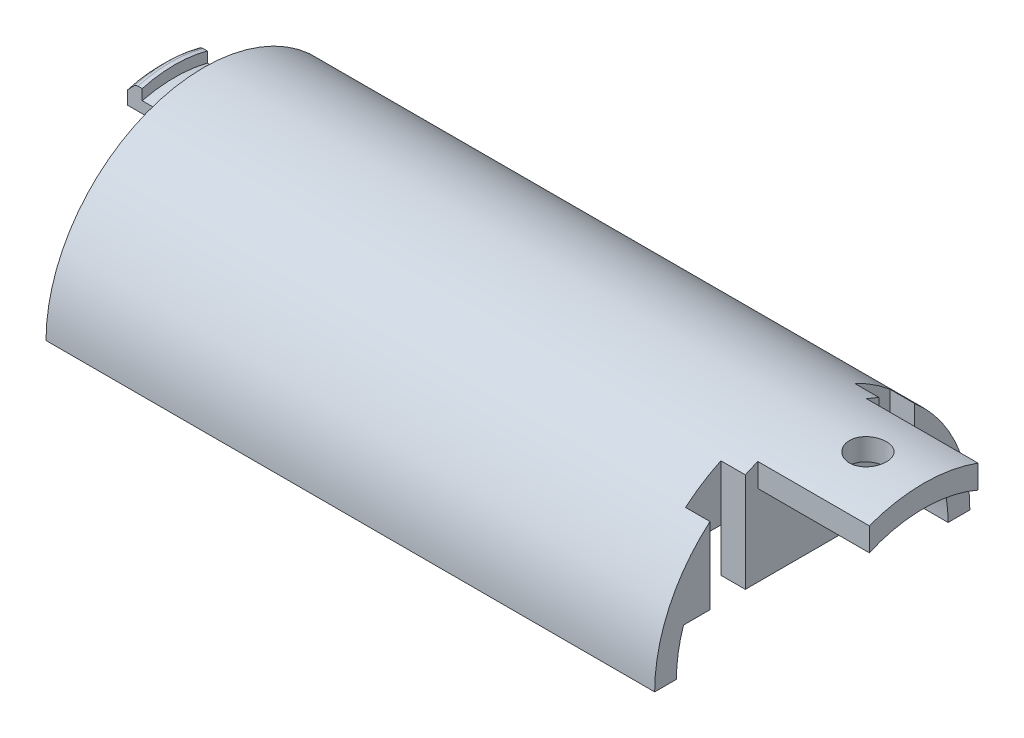
from build123d import *

# Parameters (mm, degrees)
SALIENTE_EXTRUIR1_DEPTH  = 30.75
SALIENTE_EXTRUIR2_DEPTH  = 2
SALIENTE_EXTRUIR3_DEPTH  = 20
SALIENTE_EXTRUIR4_START  = 3
SALIENTE_EXTRUIR4_DEPTH  = 3
CROQUIS6_W               = 2
CROQUIS6_H               = 6
SALIENTE_EXTRUIR6_DEPTH  = 2.5
CORTAR_EXTRUIR1_REACH    = 66.829
SALIENTE_EXTRUIR7_START  = 4
SALIENTE_EXTRUIR7_DEPTH  = 4
SALIENTE_EXTRUIR9_DEPTH  = 1.35
CHAFL_N3_SIZE            = 0.75
REDONDEO1_R              = 0.5
CHAFL_N4_SIZE            = 1
CORTAR_EXTRUIR2_DEPTH    = 5.5
SALIENTE_EXTRUIR10_START = 10.25
SALIENTE_EXTRUIR10_DEPTH = 10.25
CORTAR_EXTRUIR3_REACH    = 42.997
CROQUIS11_R              = 1.7
CROQUIS14_W              = 2.25
CROQUIS14_H              = 3.25
CORTAR_EXTRUIR6_DEPTH    = 40.758647011


with BuildPart() as part:
    # Croquis2 → Saliente-Extruir1 (new, symmetric)
    with BuildSketch(Plane.YZ):
        with BuildLine():
            Line((0, -12.5), (0, -14.5))
            ThreePointArc((0, -14.5), (14.5, 0), (0, 14.5))
            Line((0, 14.5), (0, 12.5))
            ThreePointArc((0, 12.5), (12.5, 0), (0, -12.5))
        make_face()
    extrude(amount=SALIENTE_EXTRUIR1_DEPTH, both=True)

    # Croquis3 → Saliente-Extruir2 (add)
    with BuildSketch(Plane(origin=(-21.75, 0, 0), x_dir=(0, 0, -1), z_dir=(1, 0, 0))):
        with BuildLine():
            Line((-12.5, 0), (-3.75, 0))
            ThreePointArc((-3.75, 0), (0, 3.75), (3.75, 0))
            Line((3.75, 0), (12.5, 0))
            ThreePointArc((12.5, 0), (0, 12.5), (-12.5, 0))
        make_face()
    extrude(amount=-SALIENTE_EXTRUIR2_DEPTH)

    # Croquis4 → Saliente-Extruir3 (add)
    with BuildSketch(Plane(origin=(23, 0, 0), x_dir=(0, 0, -1), z_dir=(1, 0, 0))):
        with BuildLine():
            ThreePointArc((9.604686356, 8), (0, 12.5), (-9.604686356, 8))
            Line((-9.604686356, 8), (9.604686356, 8))
        make_face()
    extrude(amount=-SALIENTE_EXTRUIR3_DEPTH)

    # Croquis4<4> → Saliente-Extruir4 (add)
    with BuildSketch(Plane(origin=(23, 0, 0), x_dir=(0, 0, -1), z_dir=(1, 0, 0)).offset(SALIENTE_EXTRUIR4_START)):
        with BuildLine():
            Line((-11.842719282, 4), (11.842719282, 4))
            ThreePointArc((11.842719282, 4), (0, 12.5), (-11.842719282, 4))
        make_face()
    extrude(amount=-SALIENTE_EXTRUIR4_DEPTH)

    # Croquis6 → Saliente-Extruir6 (add)
    with BuildSketch(Plane(origin=(0, 13.5, 0), x_dir=(-1, 0, 0), z_dir=(0, 1, 0))):
        with Locations((29.75, 0)):
            Rectangle(CROQUIS6_W, CROQUIS6_H)
    extrude(amount=-SALIENTE_EXTRUIR6_DEPTH)

    # Croquis7 → Cortar-Extruir1 (cut, up to next)
    with BuildSketch(Plane(origin=(-30.75, 0, 0), x_dir=(0, -1, 0), z_dir=(-1, 0, 0)), mode=Mode.PRIVATE) as cortar_extruir1_sk1:
        with BuildLine():
            Line((-11, -3), (-11, 3))
            ThreePointArc((-11, 3), (-11.401754251, 0), (-11, -3))
        make_face()
    cortar_extruir1_tool1 = extrude(cortar_extruir1_sk1.sketch, amount=-CORTAR_EXTRUIR1_REACH, mode=Mode.PRIVATE) & part.part
    add(cortar_extruir1_tool1.solids().sort_by_distance((-30.75, 11.160947, 0))[0], mode=Mode.SUBTRACT)

    # Croquis7<4> → Saliente-Extruir7 (add)
    with BuildSketch(Plane(origin=(-30.75, 0, 0), x_dir=(0, -1, 0), z_dir=(-1, 0, 0)).offset(SALIENTE_EXTRUIR7_START)):
        with BuildLine():
            ThreePointArc((-11, -3), (-11.401754251, 0), (-11, 3))
            Line((-11, 3), (-12.033432948, 3))
            ThreePointArc((-12.033432948, 3), (-12.401754251, 0), (-12.033432948, -3))
            Line((-12.033432948, -3), (-11, -3))
        make_face()
    extrude(amount=-SALIENTE_EXTRUIR7_DEPTH)

    # Croquis8 → Saliente-Extruir9 (add)
    with BuildSketch(Plane(origin=(-34.75, 0, 0), x_dir=(0, -1, 0), z_dir=(-1, 0, 0))):
        with BuildLine():
            Line((-11, 3), (-13, 3))
            ThreePointArc((-13, 3), (-13.401754251, 0), (-13, -3))
            Line((-13, -3), (-11, -3))
            ThreePointArc((-11, -3), (-11.401754251, 0), (-11, 3))
        make_face()
    extrude(amount=-SALIENTE_EXTRUIR9_DEPTH)

    # Chaflán3
    chafl_n3_edges = [part.edges().sort_by_distance(p)[0] for p in [
        (-34.75, 13.401754251, 0),
    ]]
    chamfer(chafl_n3_edges, length=CHAFL_N3_SIZE)

    # Redondeo1
    redondeo1_edges = [part.edges().sort_by_distance(p)[0] for p in [
        (-34, 13.401754251, 0),
    ]]
    fillet(redondeo1_edges, radius=REDONDEO1_R)

    # Chaflán4
    chafl_n4_edges = [part.edges().sort_by_distance(p)[0] for p in [
        (-28.75, 12.5, 0),
    ]]
    chamfer(chafl_n4_edges, length=CHAFL_N4_SIZE)

    # Croquis9 → Cortar-Extruir2 (cut)
    with BuildSketch(Plane.YZ.offset(30.75)):
        with BuildLine():
            Line((4, 11.842719282), (4, -11.842719282))
            ThreePointArc((4, -11.842719282), (2.026821276, -12.33458534), (0, -12.5))
            Line((0, -12.5), (0, -14.5))
            ThreePointArc((0, -14.5), (14.5, 0), (0, 14.5))
            Line((0, 14.5), (0, 12.5))
            ThreePointArc((0, 12.5), (2.026821276, 12.33458534), (4, 11.842719282))
        make_face()
    extrude(amount=-CORTAR_EXTRUIR2_DEPTH, mode=Mode.SUBTRACT)

    # Croquis10 → Saliente-Extruir10 (add)
    with BuildSketch(Plane.YZ.offset(25.25).offset(SALIENTE_EXTRUIR10_START)):
        with BuildLine():
            Line((11.456439237, 5), (13.610657589, 5))
            ThreePointArc((13.610657589, 5), (14.5, 0), (13.610657589, -5))
            Line((13.610657589, -5), (11.456439237, -5))
            ThreePointArc((11.456439237, -5), (12.5, 0), (11.456439237, 5))
        make_face()
    extrude(amount=-SALIENTE_EXTRUIR10_DEPTH)

    # Croquis11 → Cortar-Extruir3 (cut, up to next)
    with BuildSketch(Plane(origin=(0, 14.5, 0), x_dir=(-1, 0, 0), z_dir=(0, 1, 0)), mode=Mode.PRIVATE) as cortar_extruir3_sk1:
        with Locations((-30.375, 0)):
            Circle(CROQUIS11_R)
    cortar_extruir3_tool1 = extrude(cortar_extruir3_sk1.sketch, amount=-CORTAR_EXTRUIR3_REACH, mode=Mode.PRIVATE) & part.part
    add(cortar_extruir3_tool1.solids().sort_by_distance((30.375, 14.5, 0))[0], mode=Mode.SUBTRACT)

    # Croquis14 → Cortar-Extruir6 (cut, through all)
    with BuildSketch(Plane.XZ.offset(-4)):
        with Locations((24.125, 7.785)):
            Rectangle(CROQUIS14_W, CROQUIS14_H)
        with Locations((24.125, -7.785)):
            Rectangle(CROQUIS14_W, CROQUIS14_H)
    extrude(amount=-CORTAR_EXTRUIR6_DEPTH, mode=Mode.SUBTRACT)


solid = part.part
